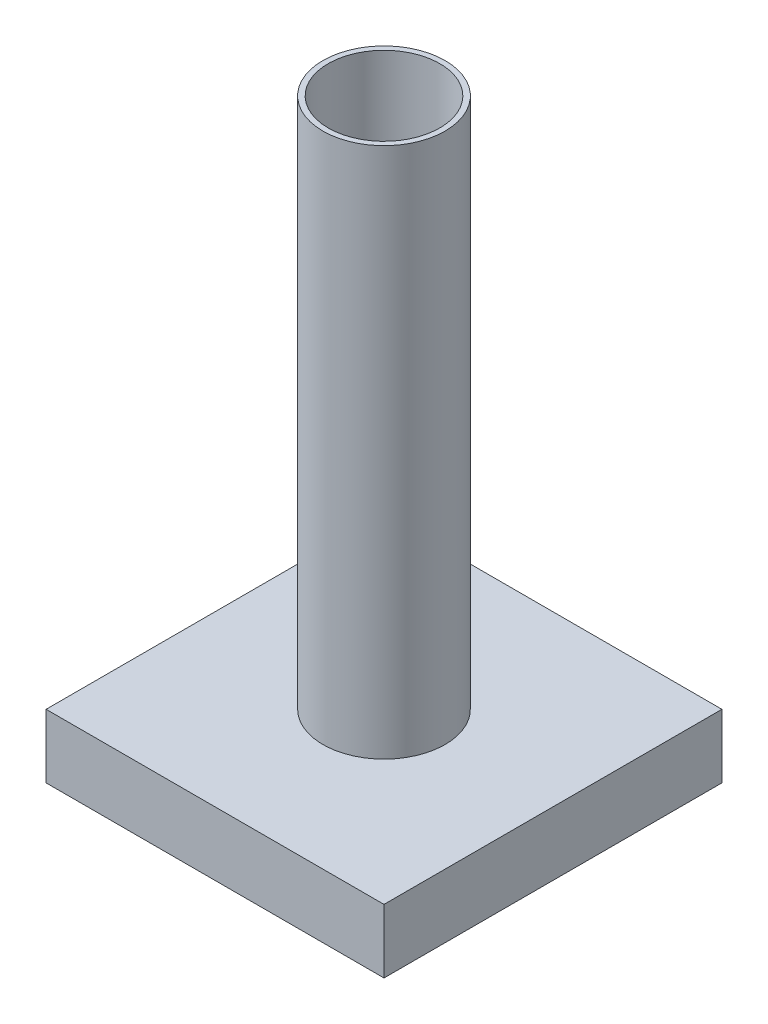
from build123d import *

# Parameters (mm, degrees)
SKETCH1_W           = 31.8
SKETCH1_H           = 31.8
BOSS_EXTRUDE2_DEPTH = 6
SKETCH5_W           = 27.8
SKETCH5_H           = 27.8
SKETCH5_R           = 3.255
SKETCH5_R_2         = 2.4
CUT_EXTRUDE2_DEPTH  = 2
SKETCH6_R           = 5
CUT_EXTRUDE3_DEPTH  = 2
SKETCH7_R           = 5.75
SKETCH7_R_2         = 5.25
BOSS_EXTRUDE4_DEPTH = 50


with BuildPart() as part:
    # Sketch1 → Boss-Extrude2 (new body)
    with BuildSketch(Plane(origin=(0, 0, 0), x_dir=(1, 0, 0), z_dir=(0, 1, 0))):
        with Locations((15.9, 15.9)):
            Rectangle(SKETCH1_W, SKETCH1_H)
    extrude(amount=-BOSS_EXTRUDE2_DEPTH)

    # Sketch5 → Cut-Extrude2 (cut)
    # profile 1 of 10: a face of its own
    with BuildSketch(Plane.XZ.offset(6)):
        with Locations((15.9, -15.9)):
            Rectangle(SKETCH5_W, SKETCH5_H)
        with Locations((7.9, -23.9)):
            Circle(SKETCH5_R, mode=Mode.SUBTRACT)
        with Locations((7.9, -15.9)):
            Circle(SKETCH5_R, mode=Mode.SUBTRACT)
        with Locations((15.9, -23.9)):
            Circle(SKETCH5_R, mode=Mode.SUBTRACT)
        with Locations((23.9, -23.9)):
            Circle(SKETCH5_R, mode=Mode.SUBTRACT)
        with Locations((15.9, -15.9)):
            Circle(SKETCH5_R, mode=Mode.SUBTRACT)
        with Locations((7.9, -7.9)):
            Circle(SKETCH5_R, mode=Mode.SUBTRACT)
        with Locations((15.9, -7.9)):
            Circle(SKETCH5_R, mode=Mode.SUBTRACT)
        with Locations((23.9, -15.9)):
            Circle(SKETCH5_R, mode=Mode.SUBTRACT)
        with Locations((23.9, -7.9)):
            Circle(SKETCH5_R, mode=Mode.SUBTRACT)
    # profile 2 of 10: a face of its own
    with BuildSketch(Plane.XZ.offset(6)):
        with Locations((23.9, -7.9)):
            Circle(SKETCH5_R_2)
    # profile 3 of 10: a face of its own
    with BuildSketch(Plane.XZ.offset(6)):
        with Locations((15.9, -7.9)):
            Circle(SKETCH5_R_2)
    # profile 4 of 10: a face of its own
    with BuildSketch(Plane.XZ.offset(6)):
        with Locations((7.9, -7.9)):
            Circle(SKETCH5_R_2)
    # profile 5 of 10: a face of its own
    with BuildSketch(Plane.XZ.offset(6)):
        with Locations((15.9, -15.9)):
            Circle(SKETCH5_R_2)
    # profile 6 of 10: a face of its own
    with BuildSketch(Plane.XZ.offset(6)):
        with Locations((7.9, -15.9)):
            Circle(SKETCH5_R_2)
    # profile 7 of 10: a face of its own
    with BuildSketch(Plane.XZ.offset(6)):
        with Locations((15.9, -23.9)):
            Circle(SKETCH5_R_2)
    # profile 8 of 10: a face of its own
    with BuildSketch(Plane.XZ.offset(6)):
        with Locations((7.9, -23.9)):
            Circle(SKETCH5_R_2)
    # profile 9 of 10: a face of its own
    with BuildSketch(Plane.XZ.offset(6)):
        with Locations((23.9, -15.9)):
            Circle(SKETCH5_R_2)
    # profile 10 of 10: a face of its own
    with BuildSketch(Plane.XZ.offset(6)):
        with Locations((23.9, -23.9)):
            Circle(SKETCH5_R_2)
    extrude(amount=-CUT_EXTRUDE2_DEPTH, mode=Mode.SUBTRACT)

    # Sketch6 → Cut-Extrude3 (cut)
    with BuildSketch(Plane(origin=(0, 0, 0), x_dir=(1, 0, 0), z_dir=(0, 1, 0))):
        with Locations((15.9, 15.9)):
            Circle(SKETCH6_R)
    extrude(amount=-CUT_EXTRUDE3_DEPTH, mode=Mode.SUBTRACT)

    # Sketch7 → Boss-Extrude4 (add)
    with BuildSketch(Plane(origin=(0, 0, 0), x_dir=(1, 0, 0), z_dir=(0, 1, 0))):
        with Locations((15.9, 15.9)):
            Circle(SKETCH7_R)
        with Locations((15.9, 15.9)):
            Circle(SKETCH7_R_2, mode=Mode.SUBTRACT)
    extrude(amount=BOSS_EXTRUDE4_DEPTH)


solid = part.part
